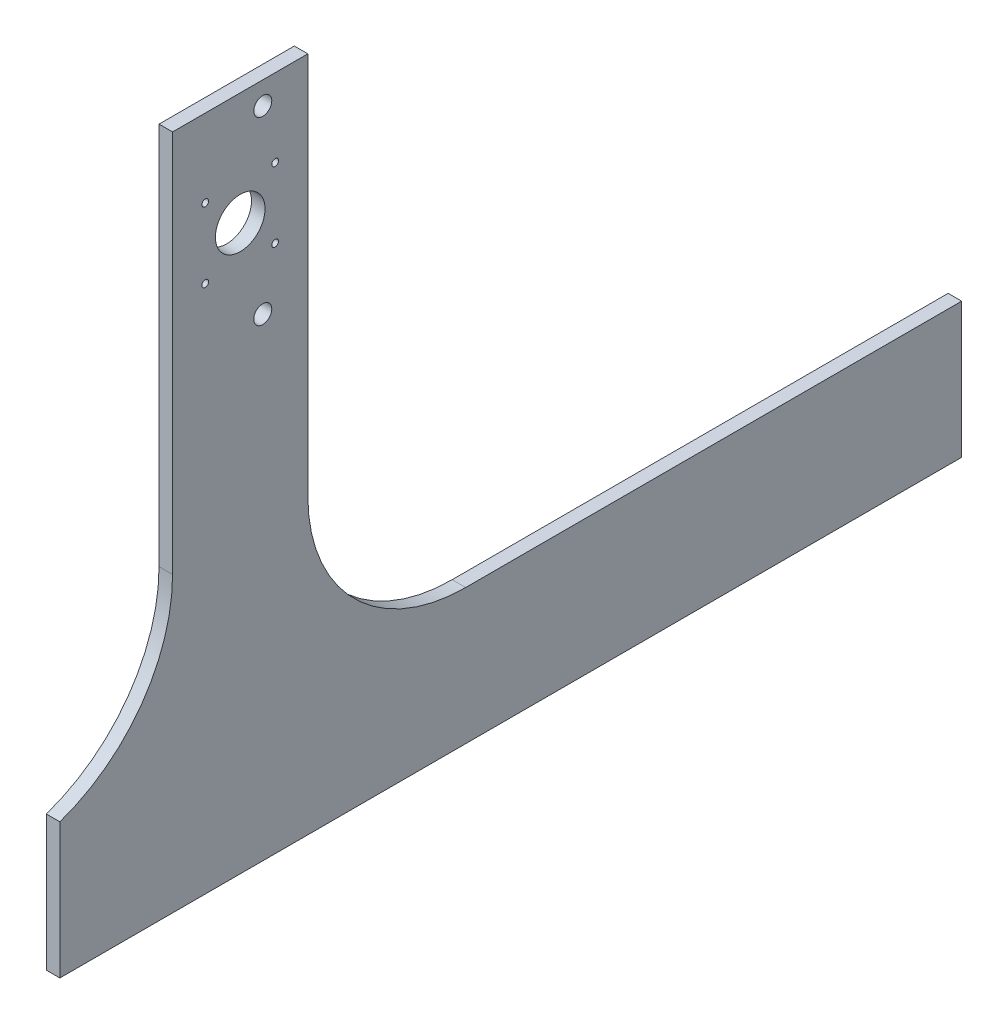
from build123d import *

# Parameters (mm, degrees)
SKETCH1_R           = 4
SKETCH1_R_2         = 1.5
SKETCH1_R_3         = 11
BOSS_EXTRUDE1_DEPTH = 6


with BuildPart() as part:
    # Sketch1 → Boss-Extrude1 (new body)
    with BuildSketch(Plane(origin=(0, 0, 0), x_dir=(0, 0, -1), z_dir=(1, 0, 0))):
        with BuildLine():
            Line((-80, -300), (320, -300))
            Line((320, -300), (320, -240))
            Line((320, -240), (100, -240))
            ThreePointArc((100, -240), (50.502525317, -219.497474683), (30, -170))
            Line((30, -170), (30, 0))
            Line((30, 0), (-30, 0))
            Line((-30, 0), (-30, -170))
            ThreePointArc((-30, -170), (-43.783723131, -213.011626335), (-80, -240))
            Line((-80, -240), (-80, -300))
        make_face()
        with Locations((10, -90)):
            Circle(SKETCH1_R, mode=Mode.SUBTRACT)
        with Locations((10, -10)):
            Circle(SKETCH1_R, mode=Mode.SUBTRACT)
        with Locations((15.5, -34.5)):
            Circle(SKETCH1_R_2, mode=Mode.SUBTRACT)
        with Locations((-15.5, -34.5)):
            Circle(SKETCH1_R_2, mode=Mode.SUBTRACT)
        with Locations((15.5, -65.5)):
            Circle(SKETCH1_R_2, mode=Mode.SUBTRACT)
        with Locations((-15.5, -65.5)):
            Circle(SKETCH1_R_2, mode=Mode.SUBTRACT)
        with Locations((0, -50)):
            Circle(SKETCH1_R_3, mode=Mode.SUBTRACT)
    extrude(amount=BOSS_EXTRUDE1_DEPTH)


solid = part.part
